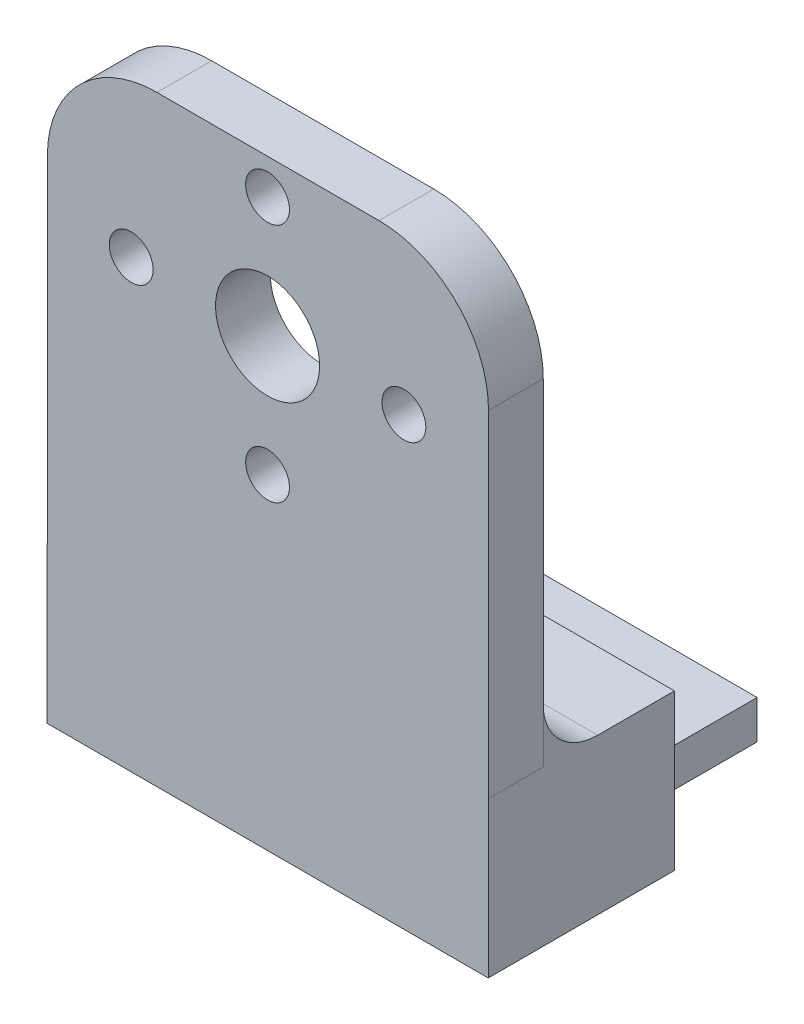
from build123d import *

# Parameters (mm, degrees)
BOSS_EXTRUDE1_DEPTH      = 11
BOSS_EXTRUDE1_DEPTH_BACK = 3.2
SKETCH1_W                = 40.3
SKETCH1_H                = 17
BOSS_EXTRUDE2_DEPTH      = 9.7
SKETCH3_W                = 40.274755135
SKETCH3_H                = 5
BOSS_EXTRUDE3_DEPTH      = 40.7
SKETCH4_R                = 2
SKETCH4_R_2              = 4.75
CUT_EXTRUDE1_DEPTH       = 5
FILLET1_R                = 10
FILLET2_R                = 5


with BuildPart() as part:
    # Sketch1 → Boss-Extrude1 (new, two sides: drawn at the far end of the back side and taken through both)
    with BuildSketch(Plane(origin=(0, 0, 0), x_dir=(1, 0, 0), z_dir=(0, 1, 0)).offset(-BOSS_EXTRUDE1_DEPTH_BACK)):
        Rectangle(SKETCH1_W, SKETCH1_H)
    extrude(amount=BOSS_EXTRUDE1_DEPTH + BOSS_EXTRUDE1_DEPTH_BACK)

    # Sketch2 → Boss-Extrude2 (add)
    with BuildSketch(Plane(origin=(0, 0, -8.5), x_dir=(-1, 0, 0), z_dir=(0, 0, -1))):
        Polygon((0, 4.557110743), (-18, 4.557110743), (-18, 1.043971306), (18, 1.043971306), (18, 4.557110743), align=None)
    extrude(amount=BOSS_EXTRUDE2_DEPTH)

    # Sketch3 → Boss-Extrude3 (add)
    with BuildSketch(Plane(origin=(0, 11, 0), x_dir=(1, 0, 0), z_dir=(0, 1, 0))):
        with Locations((0.035821087, -6)):
            Rectangle(SKETCH3_W, SKETCH3_H)
    extrude(amount=BOSS_EXTRUDE3_DEPTH)

    # Sketch4 → Cut-Extrude1 (cut)
    with BuildSketch(Plane.XY.offset(8.5)):
        with Locations((0, 26.525)):
            Circle(SKETCH4_R)
        with Locations((-12.45, 37.5)):
            Circle(SKETCH4_R)
        with Locations((12.45, 37.5)):
            Circle(SKETCH4_R)
        with Locations((0, 37.5)):
            Circle(SKETCH4_R_2)
        with Locations((0, 48.475)):
            Circle(SKETCH4_R)
    extrude(amount=-CUT_EXTRUDE1_DEPTH, mode=Mode.SUBTRACT)

    # Fillet1
    fillet1_edges = [part.edges().sort_by_distance(p)[0] for p in [
        (-20.10155648, 51.7, 6),
        (20.173198655, 51.7, 6),
    ]]
    fillet(fillet1_edges, radius=FILLET1_R)

    # Fillet2
    fillet2_edges = [part.edges().sort_by_distance(p)[0] for p in [
        (0.02422176, 11, 3.5),
    ]]
    fillet(fillet2_edges, radius=FILLET2_R)


solid = part.part
